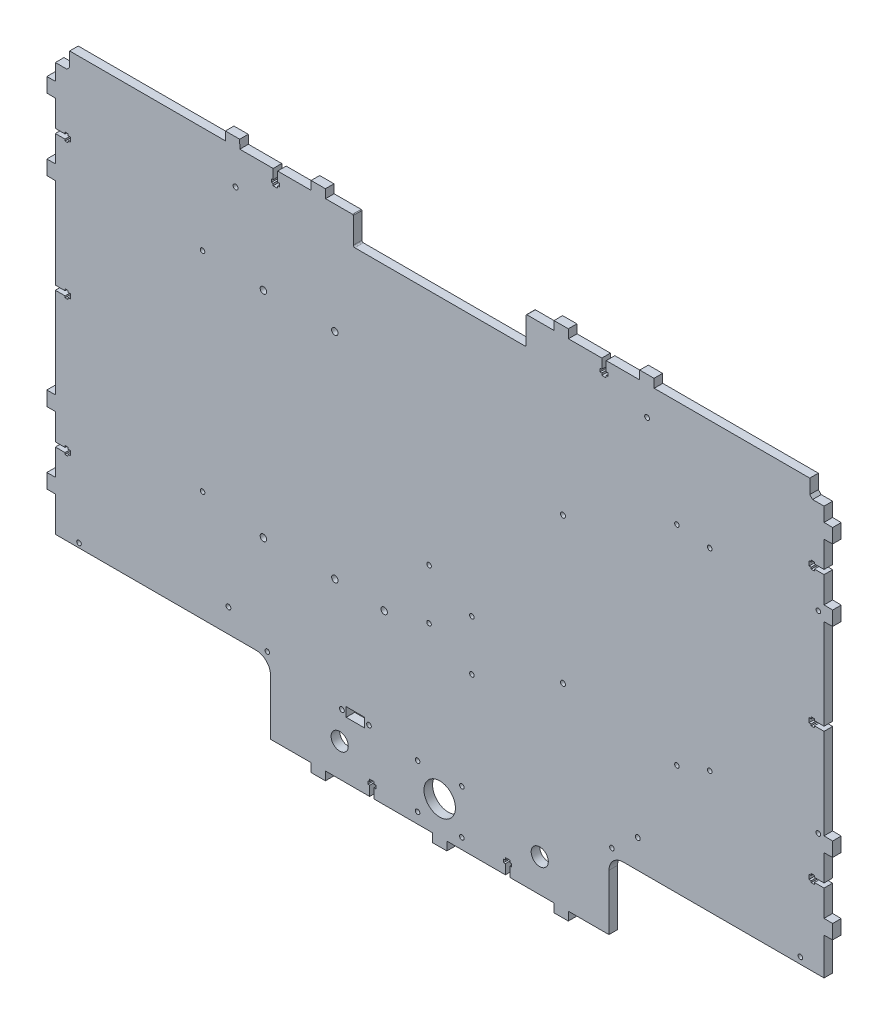
from build123d import *

# Parameters (mm, degrees)
SKETCH_1_R      = 1.6
SKETCH_1_R_2    = 1.7
SKETCH_1_R_3    = 6
SKETCH_1_W      = 13
SKETCH_1_H      = 6.5
SKETCH_1_R_4    = 1.626470027
SKETCH_1_R_5    = 2.25
SKETCH_1_R_6    = 11
SKETCH_1_R_7    = 1.75
EXTRUDE_1_DEPTH = 6


with BuildPart() as part:
    # Эскиз1 → Бобышка-Вытянуть1 (new body)
    with BuildSketch(Plane.XY):
        with BuildLine():
            Line((89.741925364, 539.042043616), (89.741925364, 500.137589553))
            Line((89.741925364, 500.137589553), (118.091925364, 500.137589553))
            Line((118.091925364, 500.137589553), (118.191925364, 494.137589553))
            Line((118.191925364, 494.137589553), (128.191925364, 494.137589553))
            Line((128.191925364, 494.137589553), (128.291925364, 500.137589553))
            Line((128.291925364, 500.137589553), (159.141925364, 500.137589553))
            Line((159.141925364, 500.137589553), (159.141925364, 506.937589553))
            Line((159.141925364, 506.937589553), (157.941925364, 506.937589553))
            Line((157.941925364, 506.937589553), (157.941925364, 509.137589553))
            Line((157.941925364, 509.137589553), (159.141925364, 509.137589553))
            Line((159.141925364, 509.137589553), (159.141925364, 510.637589553))
            Line((159.141925364, 510.637589553), (162.241925364, 510.637589553))
            Line((162.241925364, 510.637589553), (162.241925364, 509.137589553))
            Line((162.241925364, 509.137589553), (163.441925364, 509.137589553))
            Line((163.441925364, 509.137589553), (163.441925364, 506.937589553))
            Line((163.441925364, 506.937589553), (162.241925364, 506.937589553))
            Line((162.241925364, 506.937589553), (162.241925364, 500.137589553))
            Line((162.241925364, 500.137589553), (203.091925364, 500.137589553))
            Line((203.091925364, 500.137589553), (203.191925364, 494.137589553))
            Line((203.191925364, 494.137589553), (213.191925364, 494.137589553))
            Line((213.191925364, 494.137589553), (213.291925364, 500.137589553))
            Line((213.291925364, 500.137589553), (254.141925364, 500.137589553))
            Line((254.141925364, 500.137589553), (254.141925364, 506.937589553))
            Line((254.141925364, 506.937589553), (252.941925364, 506.937589553))
            Line((252.941925364, 506.937589553), (252.941925364, 509.137589553))
            Line((252.941925364, 509.137589553), (254.141925364, 509.137589553))
            Line((254.141925364, 509.137589553), (254.141925364, 510.637589553))
            Line((254.141925364, 510.637589553), (257.241925364, 510.637589553))
            Line((257.241925364, 510.637589553), (257.241925364, 509.137589553))
            Line((257.241925364, 509.137589553), (258.441925364, 509.137589553))
            Line((258.441925364, 509.137589553), (258.441925364, 506.937589553))
            Line((258.441925364, 506.937589553), (257.241925364, 506.937589553))
            Line((257.241925364, 506.937589553), (257.241925364, 500.137589553))
            Line((257.241925364, 500.137589553), (288.091925364, 500.137589553))
            Line((288.091925364, 500.137589553), (288.191925364, 494.137589553))
            Line((288.191925364, 494.137589553), (298.191925364, 494.137589553))
            Line((298.191925364, 494.137589553), (298.291925364, 500.137589553))
            Line((298.291925364, 500.137589553), (326.641925364, 500.137589553))
            Line((326.641925364, 500.137589553), (326.641925364, 539.137589553))
            ThreePointArc((326.641925364, 539.137589553), (329.570857552, 546.208657365), (336.641925364, 549.137589553))
            Line((336.641925364, 549.137589553), (377.191925364, 549.137589553))
            Line((377.191925364, 549.137589553), (477.191925364, 549.137589553))
            Line((477.191925364, 549.137589553), (477.191925364, 575.087589553))
            Line((477.191925364, 575.087589553), (483.191925364, 575.187589553))
            Line((483.191925364, 575.187589553), (483.191925364, 585.187589553))
            Line((483.191925364, 585.187589553), (477.191925364, 585.287589553))
            Line((477.191925364, 585.287589553), (477.191925364, 603.637589553))
            Line((477.191925364, 603.637589553), (470.391925364, 603.637589553))
            Line((470.391925364, 603.637589553), (470.391925364, 602.437589553))
            Line((470.391925364, 602.437589553), (468.191925364, 602.437589553))
            Line((468.191925364, 602.437589553), (468.191925364, 603.637589553))
            Line((468.191925364, 603.637589553), (466.691925364, 603.637589553))
            Line((466.691925364, 603.637589553), (466.691925364, 606.737589553))
            Line((466.691925364, 606.737589553), (468.191925364, 606.737589553))
            Line((468.191925364, 606.737589553), (468.191925364, 607.937589553))
            Line((468.191925364, 607.937589553), (470.391925364, 607.937589553))
            Line((470.391925364, 607.937589553), (470.391925364, 606.737589553))
            Line((470.391925364, 606.737589553), (477.191925364, 606.737589553))
            Line((477.191925364, 606.737589553), (477.191925364, 625.087589553))
            Line((477.191925364, 625.087589553), (483.191925364, 625.187589553))
            Line((483.191925364, 625.187589553), (483.191925364, 635.187589553))
            Line((483.191925364, 635.187589553), (477.191925364, 635.287589553))
            Line((477.191925364, 635.287589553), (477.191925364, 698.637589553))
            Line((477.191925364, 698.637589553), (470.391925364, 698.637589553))
            Line((470.391925364, 698.637589553), (470.391925364, 697.437589553))
            Line((470.391925364, 697.437589553), (468.191925364, 697.437589553))
            Line((468.191925364, 697.437589553), (468.191925364, 698.637589553))
            Line((468.191925364, 698.637589553), (466.691925364, 698.637589553))
            Line((466.691925364, 698.637589553), (466.691925364, 701.737589553))
            Line((466.691925364, 701.737589553), (468.191925364, 701.737589553))
            Line((468.191925364, 701.737589553), (468.191925364, 702.937589553))
            Line((468.191925364, 702.937589553), (470.391925364, 702.937589553))
            Line((470.391925364, 702.937589553), (470.391925364, 701.737589553))
            Line((470.391925364, 701.737589553), (477.191925364, 701.737589553))
            Line((477.191925364, 701.737589553), (477.191925364, 765.087589553))
            Line((477.191925364, 765.087589553), (483.191925364, 765.187589553))
            Line((483.191925364, 765.187589553), (483.191925364, 775.187589553))
            Line((483.191925364, 775.187589553), (477.191925364, 775.287589553))
            Line((477.191925364, 775.287589553), (477.191925364, 793.637589553))
            Line((477.191925364, 793.637589553), (470.391925364, 793.637589553))
            Line((470.391925364, 793.637589553), (470.391925364, 792.437589553))
            Line((470.391925364, 792.437589553), (468.191925364, 792.437589553))
            Line((468.191925364, 792.437589553), (468.191925364, 793.637589553))
            Line((468.191925364, 793.637589553), (466.691925364, 793.637589553))
            Line((466.691925364, 793.637589553), (466.691925364, 796.737589553))
            Line((466.691925364, 796.737589553), (468.191925364, 796.737589553))
            Line((468.191925364, 796.737589553), (468.191925364, 797.937589553))
            Line((468.191925364, 797.937589553), (470.391925364, 797.937589553))
            Line((470.391925364, 797.937589553), (470.391925364, 796.737589553))
            Line((470.391925364, 796.737589553), (477.191925364, 796.737589553))
            Line((477.191925364, 796.737589553), (477.191925364, 815.087589553))
            Line((477.191925364, 815.087589553), (483.191925364, 815.187589553))
            Line((483.191925364, 815.187589553), (483.191925364, 825.187589553))
            Line((483.191925364, 825.187589553), (477.191925364, 825.287589553))
            Line((477.191925364, 825.287589553), (477.191925364, 835.137589553))
            Line((477.191925364, 835.137589553), (469.191925364, 835.137589553))
            Line((469.191925364, 835.137589553), (467.191925364, 837.137589553))
            Line((467.191925364, 837.137589553), (467.191925364, 847.137589553))
            Line((467.191925364, 847.137589553), (367.191925364, 847.137589553))
            Line((367.191925364, 847.137589553), (358.291925364, 847.137589553))
            Line((358.291925364, 847.137589553), (358.191925364, 853.137589553))
            Line((358.191925364, 853.137589553), (348.191925364, 853.137589553))
            Line((348.191925364, 853.137589553), (348.091925364, 847.137589553))
            Line((348.091925364, 847.137589553), (324.741925364, 847.137589553))
            Line((324.741925364, 847.137589553), (324.741925364, 840.337589553))
            Line((324.741925364, 840.337589553), (325.941925364, 840.337589553))
            Line((325.941925364, 840.337589553), (325.941925364, 838.137589553))
            Line((325.941925364, 838.137589553), (324.741925364, 838.137589553))
            Line((324.741925364, 838.137589553), (324.741925364, 836.637589553))
            Line((324.741925364, 836.637589553), (321.641925364, 836.637589553))
            Line((321.641925364, 836.637589553), (321.641925364, 838.137589553))
            Line((321.641925364, 838.137589553), (320.441925364, 838.137589553))
            Line((320.441925364, 838.137589553), (320.441925364, 840.337589553))
            Line((320.441925364, 840.337589553), (321.641925364, 840.337589553))
            Line((321.641925364, 840.337589553), (321.641925364, 847.137589553))
            Line((321.641925364, 847.137589553), (298.291925364, 847.137589553))
            Line((298.291925364, 847.137589553), (298.191925364, 853.137589553))
            Line((298.191925364, 853.137589553), (288.191925364, 853.137589553))
            Line((288.191925364, 853.137589553), (288.091925364, 847.137589553))
            Line((288.091925364, 847.137589553), (269.191925364, 847.137589553))
            ThreePointArc((269.191925364, 847.137589553), (268.838371974, 846.991142943), (268.691925364, 846.637589553))
            Line((268.691925364, 846.637589553), (268.691925364, 828.542043616))
            ThreePointArc((268.691925364, 828.542043616), (268.399032145, 827.834936835), (267.691925364, 827.542043616))
            Line((267.691925364, 827.542043616), (148.691925364, 827.542043616))
            ThreePointArc((148.691925364, 827.542043616), (147.984818583, 827.834936835), (147.691925364, 828.542043616))
            Line((147.691925364, 828.542043616), (147.691925364, 846.542043616))
            ThreePointArc((147.691925364, 846.542043616), (147.545478755, 846.895597007), (147.191925364, 847.042043616))
            Line((147.191925364, 847.042043616), (128.291925364, 847.042043616))
            Line((128.291925364, 847.042043616), (128.191925364, 853.042043616))
            Line((128.191925364, 853.042043616), (118.191925364, 853.042043616))
            Line((118.191925364, 853.042043616), (118.091925364, 847.042043616))
            Line((118.091925364, 847.042043616), (94.741925364, 847.042043616))
            Line((94.741925364, 847.042043616), (94.741925364, 840.242043616))
            Line((94.741925364, 840.242043616), (95.941925364, 840.242043616))
            Line((95.941925364, 840.242043616), (95.941925364, 838.042043616))
            Line((95.941925364, 838.042043616), (94.741925364, 838.042043616))
            Line((94.741925364, 838.042043616), (94.741925364, 836.542043616))
            Line((94.741925364, 836.542043616), (91.641925364, 836.542043616))
            Line((91.641925364, 836.542043616), (91.641925364, 838.042043616))
            Line((91.641925364, 838.042043616), (90.441925364, 838.042043616))
            Line((90.441925364, 838.042043616), (90.441925364, 840.242043616))
            Line((90.441925364, 840.242043616), (91.641925364, 840.242043616))
            Line((91.641925364, 840.242043616), (91.641925364, 847.042043616))
            Line((91.641925364, 847.042043616), (68.291925364, 847.042043616))
            Line((68.291925364, 847.042043616), (68.191925364, 853.042043616))
            Line((68.191925364, 853.042043616), (58.191925364, 853.042043616))
            Line((58.191925364, 853.042043616), (58.091925364, 847.042043616))
            Line((58.091925364, 847.042043616), (49.191925364, 847.042043616))
            Line((49.191925364, 847.042043616), (-50.808074636, 847.042043616))
            Line((-50.808074636, 847.042043616), (-50.808074636, 837.042043616))
            Line((-50.808074636, 837.042043616), (-52.808074636, 835.042043616))
            Line((-52.808074636, 835.042043616), (-60.808074636, 835.042043616))
            Line((-60.808074636, 835.042043616), (-60.808074636, 823.642043616))
            Line((-60.808074636, 823.642043616), (-66.808074636, 823.542043616))
            Line((-66.808074636, 823.542043616), (-66.808074636, 813.542043616))
            Line((-66.808074636, 813.542043616), (-60.808074636, 813.442043616))
            Line((-60.808074636, 813.442043616), (-60.808074636, 795.092043616))
            Line((-60.808074636, 795.092043616), (-54.008074636, 795.092043616))
            Line((-54.008074636, 795.092043616), (-54.008074636, 796.292043616))
            Line((-54.008074636, 796.292043616), (-51.808074636, 796.292043616))
            Line((-51.808074636, 796.292043616), (-51.808074636, 795.092043616))
            Line((-51.808074636, 795.092043616), (-50.308074636, 795.092043616))
            Line((-50.308074636, 795.092043616), (-50.308074636, 791.992043616))
            Line((-50.308074636, 791.992043616), (-51.808074636, 791.992043616))
            Line((-51.808074636, 791.992043616), (-51.808074636, 790.792043616))
            Line((-51.808074636, 790.792043616), (-54.008074636, 790.792043616))
            Line((-54.008074636, 790.792043616), (-54.008074636, 791.992043616))
            Line((-54.008074636, 791.992043616), (-60.808074636, 791.992043616))
            Line((-60.808074636, 791.992043616), (-60.808074636, 773.642043616))
            Line((-60.808074636, 773.642043616), (-66.808074636, 773.542043616))
            Line((-66.808074636, 773.542043616), (-66.808074636, 763.542043616))
            Line((-66.808074636, 763.542043616), (-60.808074636, 763.442043616))
            Line((-60.808074636, 763.442043616), (-60.808074636, 700.092043616))
            Line((-60.808074636, 700.092043616), (-54.008074636, 700.092043616))
            Line((-54.008074636, 700.092043616), (-54.008074636, 701.292043616))
            Line((-54.008074636, 701.292043616), (-51.808074636, 701.292043616))
            Line((-51.808074636, 701.292043616), (-51.808074636, 700.092043616))
            Line((-51.808074636, 700.092043616), (-50.308074636, 700.092043616))
            Line((-50.308074636, 700.092043616), (-50.308074636, 696.992043616))
            Line((-50.308074636, 696.992043616), (-51.808074636, 696.992043616))
            Line((-51.808074636, 696.992043616), (-51.808074636, 695.792043616))
            Line((-51.808074636, 695.792043616), (-54.008074636, 695.792043616))
            Line((-54.008074636, 695.792043616), (-54.008074636, 696.992043616))
            Line((-54.008074636, 696.992043616), (-60.808074636, 696.992043616))
            Line((-60.808074636, 696.992043616), (-60.808074636, 633.642043616))
            Line((-60.808074636, 633.642043616), (-66.808074636, 633.542043616))
            Line((-66.808074636, 633.542043616), (-66.808074636, 623.542043616))
            Line((-66.808074636, 623.542043616), (-60.808074636, 623.442043616))
            Line((-60.808074636, 623.442043616), (-60.808074636, 605.092043616))
            Line((-60.808074636, 605.092043616), (-54.008074636, 605.092043616))
            Line((-54.008074636, 605.092043616), (-54.008074636, 606.292043616))
            Line((-54.008074636, 606.292043616), (-51.808074636, 606.292043616))
            Line((-51.808074636, 606.292043616), (-51.808074636, 605.092043616))
            Line((-51.808074636, 605.092043616), (-50.308074636, 605.092043616))
            Line((-50.308074636, 605.092043616), (-50.308074636, 601.992043616))
            Line((-50.308074636, 601.992043616), (-51.808074636, 601.992043616))
            Line((-51.808074636, 601.992043616), (-51.808074636, 600.792043616))
            Line((-51.808074636, 600.792043616), (-54.008074636, 600.792043616))
            Line((-54.008074636, 600.792043616), (-54.008074636, 601.992043616))
            Line((-54.008074636, 601.992043616), (-60.808074636, 601.992043616))
            Line((-60.808074636, 601.992043616), (-60.808074636, 583.642043616))
            Line((-60.808074636, 583.642043616), (-66.808074636, 583.542043616))
            Line((-66.808074636, 583.542043616), (-66.808074636, 573.542043616))
            Line((-66.808074636, 573.542043616), (-60.808074636, 573.442043616))
            Line((-60.808074636, 573.442043616), (-60.808074636, 549.042043616))
            Line((-60.808074636, 549.042043616), (39.191925364, 549.042043616))
            Line((39.191925364, 549.042043616), (79.741925364, 549.042043616))
            ThreePointArc((79.741925364, 549.042043616), (86.812993176, 546.113111428), (89.741925364, 539.042043616))
        make_face()
        with Locations((-44.258074636, 552.137589553)):
            Circle(SKETCH_1_R, mode=Mode.SUBTRACT)
        with Locations((60.306923435, 565.643369962)):
            Circle(SKETCH_1_R_2, mode=Mode.SUBTRACT)
        with Locations((138.191925364, 523.137589553)):
            Circle(SKETCH_1_R_3, mode=Mode.SUBTRACT)
        with Locations((192.691925364, 507.637589553)):
            Circle(SKETCH_1_R, mode=Mode.SUBTRACT)
        with Locations((192.691925364, 538.637589553)):
            Circle(SKETCH_1_R, mode=Mode.SUBTRACT)
        with Locations((87.541925364, 552.137589553)):
            Circle(SKETCH_1_R, mode=Mode.SUBTRACT)
        with Locations((139.700153258, 543.137589553)):
            Circle(SKETCH_1_R_2, mode=Mode.SUBTRACT)
        with Locations((149.200153258, 543.147589553)):
            Rectangle(SKETCH_1_W, SKETCH_1_H, mode=Mode.SUBTRACT)
        with Locations((158.700153258, 543.137589553)):
            Circle(SKETCH_1_R_4, mode=Mode.SUBTRACT)
        with Locations((42.191925364, 626.492043616)):
            Circle(SKETCH_1_R, mode=Mode.SUBTRACT)
        with Locations((84.78568386, 619.788752578)):
            Circle(SKETCH_1_R_5, mode=Mode.SUBTRACT)
        with Locations((134.78568386, 619.788752578)):
            Circle(SKETCH_1_R_5, mode=Mode.SUBTRACT)
        with Locations((169.28568386, 617.788752578)):
            Circle(SKETCH_1_R_5, mode=Mode.SUBTRACT)
        with Locations((200.717653837, 625.897847132)):
            Circle(SKETCH_1_R, mode=Mode.SUBTRACT)
        with Locations((200.717653837, 661.157846204)):
            Circle(SKETCH_1_R, mode=Mode.SUBTRACT)
        with Locations((223.691925364, 507.637589553)):
            Circle(SKETCH_1_R, mode=Mode.SUBTRACT)
        with Locations((208.191925364, 523.137589553)):
            Circle(SKETCH_1_R_6, mode=Mode.SUBTRACT)
        with Locations((223.691925364, 538.637589553)):
            Circle(SKETCH_1_R, mode=Mode.SUBTRACT)
        with Locations((278.191925364, 523.137589553)):
            Circle(SKETCH_1_R_3, mode=Mode.SUBTRACT)
        with Locations((328.741925364, 553.687589553)):
            Circle(SKETCH_1_R, mode=Mode.SUBTRACT)
        with Locations((346.784706522, 569.071596444)):
            Circle(SKETCH_1_R_2, mode=Mode.SUBTRACT)
        with Locations((460.641925364, 553.687589553)):
            Circle(SKETCH_1_R, mode=Mode.SUBTRACT)
        with Locations((230.717653837, 609.897847132)):
            Circle(SKETCH_1_R, mode=Mode.SUBTRACT)
        with Locations((230.717653837, 645.157846204)):
            Circle(SKETCH_1_R, mode=Mode.SUBTRACT)
        with Locations((294.485262853, 636.368280179)):
            Circle(SKETCH_1_R_7, mode=Mode.SUBTRACT)
        with Locations((374.191925364, 626.492043616)):
            Circle(SKETCH_1_R, mode=Mode.SUBTRACT)
        with Locations((397.191925363, 634.750548648)):
            Circle(SKETCH_1_R, mode=Mode.SUBTRACT)
        with Locations((473.191925363, 634.750548648)):
            Circle(SKETCH_1_R, mode=Mode.SUBTRACT)
        with Locations((42.191925364, 772.492043616)):
            Circle(SKETCH_1_R, mode=Mode.SUBTRACT)
        with Locations((65.280069026, 822.688709986)):
            Circle(SKETCH_1_R_2, mode=Mode.SUBTRACT)
        with Locations((84.78568386, 769.788752578)):
            Circle(SKETCH_1_R_5, mode=Mode.SUBTRACT)
        with Locations((134.78568386, 769.788752578)):
            Circle(SKETCH_1_R_5, mode=Mode.SUBTRACT)
        with Locations((294.485262853, 738.368280179)):
            Circle(SKETCH_1_R_7, mode=Mode.SUBTRACT)
        with Locations((374.191925364, 772.492043616)):
            Circle(SKETCH_1_R, mode=Mode.SUBTRACT)
        with Locations((397.191925363, 769.750548648)):
            Circle(SKETCH_1_R, mode=Mode.SUBTRACT)
        with Locations((473.191925363, 769.750548648)):
            Circle(SKETCH_1_R, mode=Mode.SUBTRACT)
        with Locations((353.343052835, 826.939418984)):
            Circle(SKETCH_1_R_2, mode=Mode.SUBTRACT)
    extrude(amount=EXTRUDE_1_DEPTH)


solid = part.part
